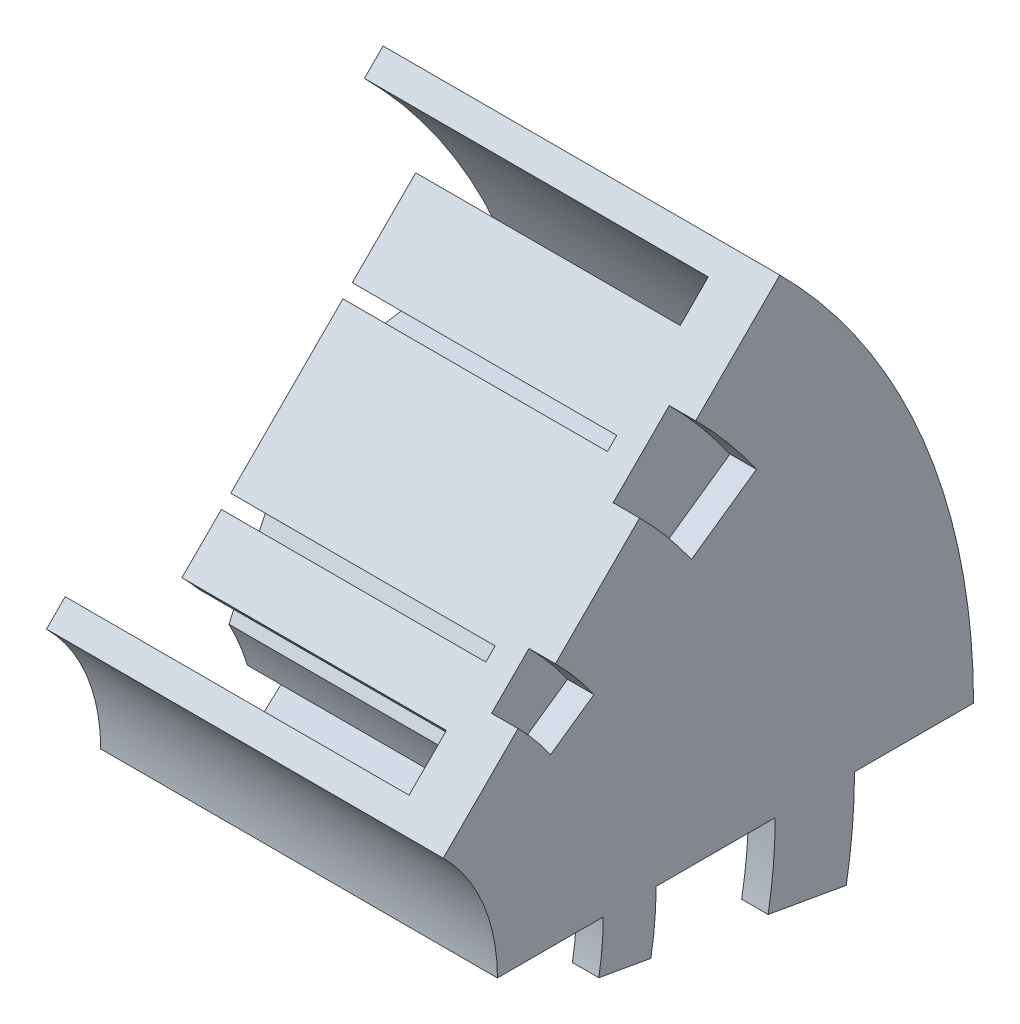
from build123d import *

# Parameters (mm, degrees)
SKETCH3_R               = 165.1
BOSS_EXTRUDE3_DEPTH     = 88.9
CAVITY1_OUTLINE_R       = 152.4
CAVITY1_OUTLINE_R_2     = 50.8
CAVITY1_DEPTH           = 82.55
CAVITY1_2_OUTLINE_R     = 50.8
CAVITY1_2_DEPTH         = 19.05
SKETCH4_R               = 47.625
CUT_EXTRUDE1_DEPTH      = 244.710981492
SKETCH5_R               = 165.1
SKETCH5_R_2             = 155.575
CUT_EXTRUDE2_DEPTH      = 250.838407776
CUT_EXTRUDE3_DEPTH      = 235.992901489
CUT_EXTRUDE3_DEPTH_BACK = 235.992901489
BOSS_EXTRUDE4_DEPTH     = 6.35
BOSS_EXTRUDE5_START     = -95.25
BOSS_EXTRUDE5_DEPTH     = 95.25
BOSS_EXTRUDE6_START     = -76.2
BOSS_EXTRUDE6_DEPTH     = 76.2
BOSS_EXTRUDE7_START     = 19.05
BOSS_EXTRUDE7_DEPTH     = 19.05


# Read off the part's stored shape, not the designer's step: Cavity1
with BuildPart() as part:
    # Sketch3 → Boss-Extrude3 (new body)
    with BuildSketch(Plane(origin=(0, 0, 0), x_dir=(0, 0, -1), z_dir=(1, 0, 0))):
        Circle(SKETCH3_R)
    extrude(amount=BOSS_EXTRUDE3_DEPTH)

    # Cavity1 outline → Cavity1 (cut)
    with BuildSketch(Plane.YZ):
        Circle(CAVITY1_OUTLINE_R)
        with BuildLine():
            ThreePointArc((-80.874334871, -117.782034216), (-101.027881362, -101.027881362), (-117.782034216, -80.874334871))
            Line((-117.782034216, -80.874334871), (-94.778746917, -76.818234675))
            Line((-94.778746917, -76.818234675), (-76.818234675, -94.778746917))
            Line((-76.818234675, -94.778746917), (-80.874334871, -117.782034216))
        make_face(mode=Mode.SUBTRACT)
        with BuildLine():
            ThreePointArc((-29.644909568, -139.765678769), (-54.675895399, -131.999288208), (-77.867142651, -119.791375818))
            Line((-77.867142651, -119.791375818), (-58.16707868, -107.241050926))
            Line((-58.16707868, -107.241050926), (-34.700538554, -116.961210108))
            Line((-34.700538554, -116.961210108), (-29.644909568, -139.765678769))
        make_face(mode=Mode.SUBTRACT)
        Polygon((-27.135112552, -136.417422958), (-32.318310369, -113.037528491), (-19.758046068, -99.330405283), (-13.399363914, -116.800740918), align=None, mode=Mode.SUBTRACT)
        Polygon((-77.274262751, -115.64910694), (-73.115814864, -92.065377038), (-56.266154796, -84.208251511), (-57.077106506, -102.782099343), align=None, mode=Mode.SUBTRACT)
        Polygon((-54.018741267, -105.522753308), (-53.132050408, -85.214193765), (-33.571867462, -72.752982915), (-27.705232431, -75.18302271), (-22.685501123, -97.825567407), (-36.418836172, -112.812872694), align=None, mode=Mode.SUBTRACT)
        Polygon((-19.446749666, -97.765412591), (-22.958048426, -81.926967419), (-14.449239382, -72.641231776), (-10.141622048, -84.476313131), align=None, mode=Mode.SUBTRACT)
        with BuildLine():
            ThreePointArc((-119.791375818, -77.867142651), (-131.999288208, -54.675895399), (-139.765678769, -29.644909568))
            Line((-139.765678769, -29.644909568), (-116.961210108, -34.700538554))
            Line((-116.961210108, -34.700538554), (-107.241050926, -58.16707868))
            Line((-107.241050926, -58.16707868), (-119.791375818, -77.867142651))
        make_face(mode=Mode.SUBTRACT)
        Polygon((-115.64910694, -77.274262751), (-102.782099343, -57.077106506), (-84.208251511, -56.266154796), (-92.065377038, -73.115814864), align=None, mode=Mode.SUBTRACT)
        Polygon((-112.812872694, -36.418836172), (-97.825567407, -22.685501123), (-75.18302271, -27.705232431), (-72.752982915, -33.571867462), (-85.214193765, -53.132050408), (-105.522753308, -54.018741267), align=None, mode=Mode.SUBTRACT)
        Polygon((-136.417422958, -27.135112552), (-116.800740918, -13.399363914), (-99.330405283, -19.758046068), (-113.037528491, -32.318310369), align=None, mode=Mode.SUBTRACT)
        Polygon((-97.765412591, -19.446749666), (-84.476313131, -10.141622048), (-72.641231776, -14.449239382), (-81.926967419, -22.958048426), align=None, mode=Mode.SUBTRACT)
        Polygon((-90.288618857, -76.818234675), (-81.697674049, -58.39489408), (-58.857722433, -54.367594373), (-54.367594373, -58.857722433), (-58.39489408, -81.697674049), (-76.818234675, -90.288618857), align=None, mode=Mode.SUBTRACT)
        Polygon((-41.147952433, -61.582262732), (-41.6973225, -74.164905949), (-55.379657648, -82.88151477), (-52.562564142, -66.904983587), align=None, mode=Mode.SUBTRACT)
        Polygon((-82.88151477, -55.379657648), (-74.164905949, -41.6973225), (-61.582262732, -41.147952433), (-66.904983587, -52.562564142), align=None, mode=Mode.SUBTRACT)
        with BuildLine():
            Line((-58.006231883, -40.991819554), (-48.83234649, -40.591279067))
            ThreePointArc((-48.83234649, -40.591279067), (-44.901280605, -44.901280605), (-40.591279067, -48.83234649))
            Line((-40.591279067, -48.83234649), (-40.991819554, -58.006231883))
            Line((-40.991819554, -58.006231883), (-47.632402282, -61.102786463))
            Line((-47.632402282, -61.102786463), (-61.102786463, -47.632402282))
            Line((-61.102786463, -47.632402282), (-58.006231883, -40.991819554))
        make_face(mode=Mode.SUBTRACT)
        with BuildLine():
            Line((-37.903880189, -60.069527002), (-29.581595449, -56.188781894))
            ThreePointArc((-29.581595449, -56.188781894), (-24.300397955, -58.666350314), (-18.814121964, -60.648815444))
            Line((-18.814121964, -60.648815444), (-15.673479171, -69.2776606))
            Line((-15.673479171, -69.2776606), (-20.623577502, -74.67974499))
            Line((-20.623577502, -74.67974499), (-38.223482596, -67.389625603))
            Line((-38.223482596, -67.389625603), (-37.903880189, -60.069527002))
        make_face(mode=Mode.SUBTRACT)
        with BuildLine():
            Line((-69.2776606, -15.673479171), (-60.648815444, -18.814121964))
            ThreePointArc((-60.648815444, -18.814121964), (-58.666350314, -24.300397955), (-56.188781894, -29.581595449))
            Line((-56.188781894, -29.581595449), (-60.069527002, -37.903880189))
            Line((-60.069527002, -37.903880189), (-67.389625603, -38.223482596))
            Line((-67.389625603, -38.223482596), (-74.67974499, -20.623577502))
            Line((-74.67974499, -20.623577502), (-69.2776606, -15.673479171))
        make_face(mode=Mode.SUBTRACT)
        with BuildLine():
            ThreePointArc((26.097684485, -140.471265708), (0, -142.875), (-26.097684485, -140.471265708))
            Line((-26.097684485, -140.471265708), (-12.7, -121.337389315))
            Line((-12.7, -121.337389315), (12.7, -121.337389315))
            Line((12.7, -121.337389315), (26.097684485, -140.471265708))
        make_face(mode=Mode.SUBTRACT)
        Polygon((27.135112552, -136.417422958), (13.399363914, -116.800740918), (19.758046068, -99.330405283), (32.318310369, -113.037528491), align=None, mode=Mode.SUBTRACT)
        with BuildLine():
            ThreePointArc((77.867142651, -119.791375818), (54.675895399, -131.999288208), (29.644909568, -139.765678769))
            Line((29.644909568, -139.765678769), (34.700538554, -116.961210108))
            Line((34.700538554, -116.961210108), (58.16707868, -107.241050926))
            Line((58.16707868, -107.241050926), (77.867142651, -119.791375818))
        make_face(mode=Mode.SUBTRACT)
        Polygon((-9.525, -118.162389315), (-16.477553736, -99.060404918), (-3.175, -80.062389315), (3.175, -80.062389315), (16.477553736, -99.060404918), (9.525, -118.162389315), align=None, mode=Mode.SUBTRACT)
        Polygon((19.446749666, -97.765412591), (10.141622048, -84.476313131), (14.449239382, -72.641231776), (22.958048426, -81.926967419), align=None, mode=Mode.SUBTRACT)
        Polygon((77.274262751, -115.64910694), (57.077106506, -102.782099343), (56.266154796, -84.208251511), (73.115814864, -92.065377038), align=None, mode=Mode.SUBTRACT)
        Polygon((36.418836172, -112.812872694), (22.685501123, -97.825567407), (27.705232431, -75.18302271), (33.571867462, -72.752982915), (53.132050408, -85.214193765), (54.018741267, -105.522753308), align=None, mode=Mode.SUBTRACT)
        with BuildLine():
            ThreePointArc((117.782034216, -80.874334871), (101.027881362, -101.027881362), (80.874334871, -117.782034216))
            Line((80.874334871, -117.782034216), (76.818234675, -94.778746917))
            Line((76.818234675, -94.778746917), (94.778746917, -76.818234675))
            Line((94.778746917, -76.818234675), (117.782034216, -80.874334871))
        make_face(mode=Mode.SUBTRACT)
        with BuildLine():
            Line((-12.031006336, -70.002193495), (-5.827314658, -63.23205203))
            ThreePointArc((-5.827314658, -63.23205203), (0, -63.5), (5.827314658, -63.23205203))
            Line((5.827314658, -63.23205203), (12.031006336, -70.002193495))
            Line((12.031006336, -70.002193495), (9.525, -76.887389315))
            Line((9.525, -76.887389315), (-9.525, -76.887389315))
            Line((-9.525, -76.887389315), (-12.031006336, -70.002193495))
        make_face(mode=Mode.SUBTRACT)
        with BuildLine():
            Line((15.673479171, -69.2776606), (18.814121964, -60.648815444))
            ThreePointArc((18.814121964, -60.648815444), (24.300397955, -58.666350314), (29.581595449, -56.188781894))
            Line((29.581595449, -56.188781894), (37.903880189, -60.069527002))
            Line((37.903880189, -60.069527002), (38.223482596, -67.389625603))
            Line((38.223482596, -67.389625603), (20.623577502, -74.67974499))
            Line((20.623577502, -74.67974499), (15.673479171, -69.2776606))
        make_face(mode=Mode.SUBTRACT)
        Polygon((55.379657648, -82.88151477), (41.6973225, -74.164905949), (41.147952433, -61.582262732), (52.562564142, -66.904983587), align=None, mode=Mode.SUBTRACT)
        Polygon((76.818234675, -90.288618857), (58.39489408, -81.697674049), (54.367594373, -58.857722433), (58.857722433, -54.367594373), (81.697674049, -58.39489408), (90.288618857, -76.818234675), align=None, mode=Mode.SUBTRACT)
        with BuildLine():
            Line((40.991819554, -58.006231883), (40.591279067, -48.83234649))
            ThreePointArc((40.591279067, -48.83234649), (44.901280605, -44.901280605), (48.83234649, -40.591279067))
            Line((48.83234649, -40.591279067), (58.006231883, -40.991819554))
            Line((58.006231883, -40.991819554), (61.102786463, -47.632402282))
            Line((61.102786463, -47.632402282), (47.632402282, -61.102786463))
            Line((47.632402282, -61.102786463), (40.991819554, -58.006231883))
        make_face(mode=Mode.SUBTRACT)
        Polygon((82.88151477, -55.379657648), (66.904983587, -52.562564142), (61.582262732, -41.147952433), (74.164905949, -41.6973225), align=None, mode=Mode.SUBTRACT)
        with BuildLine():
            Line((60.069527002, -37.903880189), (56.188781894, -29.581595449))
            ThreePointArc((56.188781894, -29.581595449), (58.666350314, -24.300397955), (60.648815444, -18.814121964))
            Line((60.648815444, -18.814121964), (69.2776606, -15.673479171))
            Line((69.2776606, -15.673479171), (74.67974499, -20.623577502))
            Line((74.67974499, -20.623577502), (67.389625603, -38.223482596))
            Line((67.389625603, -38.223482596), (60.069527002, -37.903880189))
        make_face(mode=Mode.SUBTRACT)
        Polygon((115.64910694, -77.274262751), (92.065377038, -73.115814864), (84.208251511, -56.266154796), (102.782099343, -57.077106506), align=None, mode=Mode.SUBTRACT)
        Polygon((105.522753308, -54.018741267), (85.214193765, -53.132050408), (72.752982915, -33.571867462), (75.18302271, -27.705232431), (97.825567407, -22.685501123), (112.812872694, -36.418836172), align=None, mode=Mode.SUBTRACT)
        with BuildLine():
            ThreePointArc((139.765678769, -29.644909568), (131.999288208, -54.675895399), (119.791375818, -77.867142651))
            Line((119.791375818, -77.867142651), (107.241050926, -58.16707868))
            Line((107.241050926, -58.16707868), (116.961210108, -34.700538554))
            Line((116.961210108, -34.700538554), (139.765678769, -29.644909568))
        make_face(mode=Mode.SUBTRACT)
        Polygon((97.765412591, -19.446749666), (81.926967419, -22.958048426), (72.641231776, -14.449239382), (84.476313131, -10.141622048), align=None, mode=Mode.SUBTRACT)
        Polygon((136.417422958, -27.135112552), (113.037528491, -32.318310369), (99.330405283, -19.758046068), (116.800740918, -13.399363914), align=None, mode=Mode.SUBTRACT)
        with BuildLine():
            ThreePointArc((-140.471265708, -26.097684485), (-142.875, 0), (-140.471265708, 26.097684485))
            Line((-140.471265708, 26.097684485), (-121.337389315, 12.7))
            Line((-121.337389315, 12.7), (-121.337389315, -12.7))
            Line((-121.337389315, -12.7), (-140.471265708, -26.097684485))
        make_face(mode=Mode.SUBTRACT)
        Polygon((-136.417422958, 27.135112552), (-113.037528491, 32.318310369), (-99.330405283, 19.758046068), (-116.800740918, 13.399363914), align=None, mode=Mode.SUBTRACT)
        Polygon((-118.162389315, 9.525), (-99.060404918, 16.477553736), (-80.062389315, 3.175), (-80.062389315, -3.175), (-99.060404918, -16.477553736), (-118.162389315, -9.525), align=None, mode=Mode.SUBTRACT)
        Polygon((-97.765412591, 19.446749666), (-81.926967419, 22.958048426), (-72.641231776, 14.449239382), (-84.476313131, 10.141622048), align=None, mode=Mode.SUBTRACT)
        with BuildLine():
            ThreePointArc((-139.765678769, 29.644909568), (-131.999288208, 54.675895399), (-119.791375818, 77.867142651))
            Line((-119.791375818, 77.867142651), (-107.241050926, 58.16707868))
            Line((-107.241050926, 58.16707868), (-116.961210108, 34.700538554))
            Line((-116.961210108, 34.700538554), (-139.765678769, 29.644909568))
        make_face(mode=Mode.SUBTRACT)
        Polygon((-105.522753308, 54.018741267), (-85.214193765, 53.132050408), (-72.752982915, 33.571867462), (-75.18302271, 27.705232431), (-97.825567407, 22.685501123), (-112.812872694, 36.418836172), align=None, mode=Mode.SUBTRACT)
        Polygon((-115.64910694, 77.274262751), (-92.065377038, 73.115814864), (-84.208251511, 56.266154796), (-102.782099343, 57.077106506), align=None, mode=Mode.SUBTRACT)
        with BuildLine():
            Line((-70.002193495, 12.031006336), (-63.23205203, 5.827314658))
            ThreePointArc((-63.23205203, 5.827314658), (-63.5, 0), (-63.23205203, -5.827314658))
            Line((-63.23205203, -5.827314658), (-70.002193495, -12.031006336))
            Line((-70.002193495, -12.031006336), (-76.887389315, -9.525))
            Line((-76.887389315, -9.525), (-76.887389315, 9.525))
            Line((-76.887389315, 9.525), (-70.002193495, 12.031006336))
        make_face(mode=Mode.SUBTRACT)
        with BuildLine():
            Line((-60.069527002, 37.903880189), (-56.188781894, 29.581595449))
            ThreePointArc((-56.188781894, 29.581595449), (-58.666350314, 24.300397955), (-60.648815444, 18.814121964))
            Line((-60.648815444, 18.814121964), (-69.2776606, 15.673479171))
            Line((-69.2776606, 15.673479171), (-74.67974499, 20.623577502))
            Line((-74.67974499, 20.623577502), (-67.389625603, 38.223482596))
            Line((-67.389625603, 38.223482596), (-60.069527002, 37.903880189))
        make_face(mode=Mode.SUBTRACT)
        Polygon((-61.582262732, 41.147952433), (-74.164905949, 41.6973225), (-82.88151477, 55.379657648), (-66.904983587, 52.562564142), align=None, mode=Mode.SUBTRACT)
        with BuildLine():
            Line((-40.991819554, 58.006231883), (-40.591279067, 48.83234649))
            ThreePointArc((-40.591279067, 48.83234649), (-44.901280605, 44.901280605), (-48.83234649, 40.591279067))
            Line((-48.83234649, 40.591279067), (-58.006231883, 40.991819554))
            Line((-58.006231883, 40.991819554), (-61.102786463, 47.632402282))
            Line((-61.102786463, 47.632402282), (-47.632402282, 61.102786463))
            Line((-47.632402282, 61.102786463), (-40.991819554, 58.006231883))
        make_face(mode=Mode.SUBTRACT)
        Polygon((-76.818234675, 90.288618857), (-58.39489408, 81.697674049), (-54.367594373, 58.857722433), (-58.857722433, 54.367594373), (-81.697674049, 58.39489408), (-90.288618857, 76.818234675), align=None, mode=Mode.SUBTRACT)
        Polygon((-41.147952433, 61.582262732), (-52.562564142, 66.904983587), (-55.379657648, 82.88151477), (-41.6973225, 74.164905949), align=None, mode=Mode.SUBTRACT)
        with BuildLine():
            Line((-15.673479171, 69.2776606), (-18.814121964, 60.648815444))
            ThreePointArc((-18.814121964, 60.648815444), (-24.300397955, 58.666350314), (-29.581595449, 56.188781894))
            Line((-29.581595449, 56.188781894), (-37.903880189, 60.069527002))
            Line((-37.903880189, 60.069527002), (-38.223482596, 67.389625603))
            Line((-38.223482596, 67.389625603), (-20.623577502, 74.67974499))
            Line((-20.623577502, 74.67974499), (-15.673479171, 69.2776606))
        make_face(mode=Mode.SUBTRACT)
        with BuildLine():
            ThreePointArc((-117.782034216, 80.874334871), (-101.027881362, 101.027881362), (-80.874334871, 117.782034216))
            Line((-80.874334871, 117.782034216), (-76.818234675, 94.778746917))
            Line((-76.818234675, 94.778746917), (-94.778746917, 76.818234675))
            Line((-94.778746917, 76.818234675), (-117.782034216, 80.874334871))
        make_face(mode=Mode.SUBTRACT)
        Polygon((-36.418836172, 112.812872694), (-22.685501123, 97.825567407), (-27.705232431, 75.18302271), (-33.571867462, 72.752982915), (-53.132050408, 85.214193765), (-54.018741267, 105.522753308), align=None, mode=Mode.SUBTRACT)
        Polygon((-77.274262751, 115.64910694), (-57.077106506, 102.782099343), (-56.266154796, 84.208251511), (-73.115814864, 92.065377038), align=None, mode=Mode.SUBTRACT)
        Polygon((-19.446749666, 97.765412591), (-10.141622048, 84.476313131), (-14.449239382, 72.641231776), (-22.958048426, 81.926967419), align=None, mode=Mode.SUBTRACT)
        with BuildLine():
            ThreePointArc((-77.867142651, 119.791375818), (-54.675895399, 131.999288208), (-29.644909568, 139.765678769))
            Line((-29.644909568, 139.765678769), (-34.700538554, 116.961210108))
            Line((-34.700538554, 116.961210108), (-58.16707868, 107.241050926))
            Line((-58.16707868, 107.241050926), (-77.867142651, 119.791375818))
        make_face(mode=Mode.SUBTRACT)
        Polygon((-27.135112552, 136.417422958), (-13.399363914, 116.800740918), (-19.758046068, 99.330405283), (-32.318310369, 113.037528491), align=None, mode=Mode.SUBTRACT)
        Circle(CAVITY1_OUTLINE_R_2, mode=Mode.SUBTRACT)
        with BuildLine():
            Line((70.002193495, -12.031006336), (63.23205203, -5.827314658))
            ThreePointArc((63.23205203, -5.827314658), (63.5, 0), (63.23205203, 5.827314658))
            Line((63.23205203, 5.827314658), (70.002193495, 12.031006336))
            Line((70.002193495, 12.031006336), (76.887389315, 9.525))
            Line((76.887389315, 9.525), (76.887389315, -9.525))
            Line((76.887389315, -9.525), (70.002193495, -12.031006336))
        make_face(mode=Mode.SUBTRACT)
        with BuildLine():
            Line((56.188781894, 29.581595449), (60.069527002, 37.903880189))
            Line((60.069527002, 37.903880189), (67.389625603, 38.223482596))
            Line((67.389625603, 38.223482596), (74.67974499, 20.623577502))
            Line((74.67974499, 20.623577502), (69.2776606, 15.673479171))
            Line((69.2776606, 15.673479171), (60.648815444, 18.814121964))
            ThreePointArc((60.648815444, 18.814121964), (58.666350314, 24.300397955), (56.188781894, 29.581595449))
        make_face(mode=Mode.SUBTRACT)
        with BuildLine():
            Line((12.031006336, 70.002193495), (5.827314658, 63.23205203))
            ThreePointArc((5.827314658, 63.23205203), (0, 63.5), (-5.827314658, 63.23205203))
            Line((-5.827314658, 63.23205203), (-12.031006336, 70.002193495))
            Line((-12.031006336, 70.002193495), (-9.525, 76.887389315))
            Line((-9.525, 76.887389315), (9.525, 76.887389315))
            Line((9.525, 76.887389315), (12.031006336, 70.002193495))
        make_face(mode=Mode.SUBTRACT)
        with BuildLine():
            Line((37.903880189, 60.069527002), (29.581595449, 56.188781894))
            ThreePointArc((29.581595449, 56.188781894), (24.300397955, 58.666350314), (18.814121964, 60.648815444))
            Line((18.814121964, 60.648815444), (15.673479171, 69.2776606))
            Line((15.673479171, 69.2776606), (20.623577502, 74.67974499))
            Line((20.623577502, 74.67974499), (38.223482596, 67.389625603))
            Line((38.223482596, 67.389625603), (37.903880189, 60.069527002))
        make_face(mode=Mode.SUBTRACT)
        with BuildLine():
            Line((61.102786463, 47.632402282), (58.006231883, 40.991819554))
            Line((58.006231883, 40.991819554), (48.83234649, 40.591279067))
            ThreePointArc((48.83234649, 40.591279067), (44.901280605, 44.901280605), (40.591279067, 48.83234649))
            Line((40.591279067, 48.83234649), (40.991819554, 58.006231883))
            Line((40.991819554, 58.006231883), (47.632402282, 61.102786463))
            Line((47.632402282, 61.102786463), (61.102786463, 47.632402282))
        make_face(mode=Mode.SUBTRACT)
        Polygon((82.88151477, 55.379657648), (74.164905949, 41.6973225), (61.582262732, 41.147952433), (66.904983587, 52.562564142), align=None, mode=Mode.SUBTRACT)
        Polygon((41.147952433, 61.582262732), (41.6973225, 74.164905949), (55.379657648, 82.88151477), (52.562564142, 66.904983587), align=None, mode=Mode.SUBTRACT)
        Polygon((90.288618857, 76.818234675), (81.697674049, 58.39489408), (58.857722433, 54.367594373), (54.367594373, 58.857722433), (58.39489408, 81.697674049), (76.818234675, 90.288618857), align=None, mode=Mode.SUBTRACT)
        Polygon((97.765412591, 19.446749666), (84.476313131, 10.141622048), (72.641231776, 14.449239382), (81.926967419, 22.958048426), align=None, mode=Mode.SUBTRACT)
        Polygon((99.060404918, -16.477553736), (80.062389315, -3.175), (80.062389315, 3.175), (99.060404918, 16.477553736), (118.162389315, 9.525), (118.162389315, -9.525), align=None, mode=Mode.SUBTRACT)
        with BuildLine():
            ThreePointArc((140.471265708, 26.097684485), (142.875, 0), (140.471265708, -26.097684485))
            Line((140.471265708, -26.097684485), (121.337389315, -12.7))
            Line((121.337389315, -12.7), (121.337389315, 12.7))
            Line((121.337389315, 12.7), (140.471265708, 26.097684485))
        make_face(mode=Mode.SUBTRACT)
        Polygon((113.037528491, 32.318310369), (136.417422958, 27.135112552), (116.800740918, 13.399363914), (99.330405283, 19.758046068), align=None, mode=Mode.SUBTRACT)
        Polygon((112.812872694, 36.418836172), (97.825567407, 22.685501123), (75.18302271, 27.705232431), (72.752982915, 33.571867462), (85.214193765, 53.132050408), (105.522753308, 54.018741267), align=None, mode=Mode.SUBTRACT)
        Polygon((115.64910694, 77.274262751), (102.782099343, 57.077106506), (84.208251511, 56.266154796), (92.065377038, 73.115814864), align=None, mode=Mode.SUBTRACT)
        with BuildLine():
            ThreePointArc((119.791375818, 77.867142651), (131.999288208, 54.675895399), (139.765678769, 29.644909568))
            Line((139.765678769, 29.644909568), (116.961210108, 34.700538554))
            Line((116.961210108, 34.700538554), (107.241050926, 58.16707868))
            Line((107.241050926, 58.16707868), (119.791375818, 77.867142651))
        make_face(mode=Mode.SUBTRACT)
        Polygon((14.449239382, 72.641231776), (10.141622048, 84.476313131), (19.446749666, 97.765412591), (22.958048426, 81.926967419), align=None, mode=Mode.SUBTRACT)
        Polygon((9.525, 118.162389315), (16.477553736, 99.060404918), (3.175, 80.062389315), (-3.175, 80.062389315), (-16.477553736, 99.060404918), (-9.525, 118.162389315), align=None, mode=Mode.SUBTRACT)
        Polygon((54.018741267, 105.522753308), (53.132050408, 85.214193765), (33.571867462, 72.752982915), (27.705232431, 75.18302271), (22.685501123, 97.825567407), (36.418836172, 112.812872694), align=None, mode=Mode.SUBTRACT)
        Polygon((77.274262751, 115.64910694), (73.115814864, 92.065377038), (56.266154796, 84.208251511), (57.077106506, 102.782099343), align=None, mode=Mode.SUBTRACT)
        with BuildLine():
            ThreePointArc((-26.097684485, 140.471265708), (0, 142.875), (26.097684485, 140.471265708))
            Line((26.097684485, 140.471265708), (12.7, 121.337389315))
            Line((12.7, 121.337389315), (-12.7, 121.337389315))
            Line((-12.7, 121.337389315), (-26.097684485, 140.471265708))
        make_face(mode=Mode.SUBTRACT)
        Polygon((27.135112552, 136.417422958), (32.318310369, 113.037528491), (19.758046068, 99.330405283), (13.399363914, 116.800740918), align=None, mode=Mode.SUBTRACT)
        with BuildLine():
            ThreePointArc((29.644909568, 139.765678769), (54.675895399, 131.999288208), (77.867142651, 119.791375818))
            Line((77.867142651, 119.791375818), (58.16707868, 107.241050926))
            Line((58.16707868, 107.241050926), (34.700538554, 116.961210108))
            Line((34.700538554, 116.961210108), (29.644909568, 139.765678769))
        make_face(mode=Mode.SUBTRACT)
        with BuildLine():
            ThreePointArc((80.874334871, 117.782034216), (101.027881362, 101.027881362), (117.782034216, 80.874334871))
            Line((117.782034216, 80.874334871), (94.778746917, 76.818234675))
            Line((94.778746917, 76.818234675), (76.818234675, 94.778746917))
            Line((76.818234675, 94.778746917), (80.874334871, 117.782034216))
        make_face(mode=Mode.SUBTRACT)
    extrude(amount=CAVITY1_DEPTH, mode=Mode.SUBTRACT)

    # Cavity1 2 outline → Cavity1 2 (cut)
    with BuildSketch(Plane.YZ):
        Circle(CAVITY1_2_OUTLINE_R)
        with BuildLine():
            Line((121.337389315, -12.7), (140.471265708, -26.097684485))
            ThreePointArc((140.471265708, -26.097684485), (142.875, 0), (140.471265708, 26.097684485))
            Line((140.471265708, 26.097684485), (121.337389315, 12.7))
            Line((121.337389315, 12.7), (121.337389315, -12.7))
        make_face()
        with BuildLine():
            Line((116.961210108, 34.700538554), (139.765678769, 29.644909568))
            ThreePointArc((139.765678769, 29.644909568), (131.999288208, 54.675895399), (119.791375818, 77.867142651))
            Line((119.791375818, 77.867142651), (107.241050926, 58.16707868))
            Line((107.241050926, 58.16707868), (116.961210108, 34.700538554))
        make_face()
        with BuildLine():
            Line((94.778746917, 76.818234675), (117.782034216, 80.874334871))
            ThreePointArc((117.782034216, 80.874334871), (101.027881362, 101.027881362), (80.874334871, 117.782034216))
            Line((80.874334871, 117.782034216), (76.818234675, 94.778746917))
            Line((76.818234675, 94.778746917), (94.778746917, 76.818234675))
        make_face()
        with BuildLine():
            Line((-94.778746917, -76.818234675), (-117.782034216, -80.874334871))
            ThreePointArc((-117.782034216, -80.874334871), (-101.027881362, -101.027881362), (-80.874334871, -117.782034216))
            Line((-80.874334871, -117.782034216), (-76.818234675, -94.778746917))
            Line((-76.818234675, -94.778746917), (-94.778746917, -76.818234675))
        make_face()
        with BuildLine():
            Line((76.818234675, -94.778746917), (80.874334871, -117.782034216))
            ThreePointArc((80.874334871, -117.782034216), (101.027881362, -101.027881362), (117.782034216, -80.874334871))
            Line((117.782034216, -80.874334871), (94.778746917, -76.818234675))
            Line((94.778746917, -76.818234675), (76.818234675, -94.778746917))
        make_face()
        with BuildLine():
            Line((107.241050926, -58.16707868), (119.791375818, -77.867142651))
            ThreePointArc((119.791375818, -77.867142651), (131.999288208, -54.675895399), (139.765678769, -29.644909568))
            Line((139.765678769, -29.644909568), (116.961210108, -34.700538554))
            Line((116.961210108, -34.700538554), (107.241050926, -58.16707868))
        make_face()
        with BuildLine():
            Line((-12.7, -121.337389315), (-26.097684485, -140.471265708))
            ThreePointArc((-26.097684485, -140.471265708), (0, -142.875), (26.097684485, -140.471265708))
            Line((26.097684485, -140.471265708), (12.7, -121.337389315))
            Line((12.7, -121.337389315), (-12.7, -121.337389315))
        make_face()
        with BuildLine():
            Line((-58.16707868, -107.241050926), (-77.867142651, -119.791375818))
            ThreePointArc((-77.867142651, -119.791375818), (-54.675895399, -131.999288208), (-29.644909568, -139.765678769))
            Line((-29.644909568, -139.765678769), (-34.700538554, -116.961210108))
            Line((-34.700538554, -116.961210108), (-58.16707868, -107.241050926))
        make_face()
        with BuildLine():
            Line((34.700538554, -116.961210108), (29.644909568, -139.765678769))
            ThreePointArc((29.644909568, -139.765678769), (54.675895399, -131.999288208), (77.867142651, -119.791375818))
            Line((77.867142651, -119.791375818), (58.16707868, -107.241050926))
            Line((58.16707868, -107.241050926), (34.700538554, -116.961210108))
        make_face()
        with BuildLine():
            Line((-34.700538554, 116.961210108), (-29.644909568, 139.765678769))
            ThreePointArc((-29.644909568, 139.765678769), (-54.675895399, 131.999288208), (-77.867142651, 119.791375818))
            Line((-77.867142651, 119.791375818), (-58.16707868, 107.241050926))
            Line((-58.16707868, 107.241050926), (-34.700538554, 116.961210108))
        make_face()
        with BuildLine():
            Line((58.16707868, 107.241050926), (77.867142651, 119.791375818))
            ThreePointArc((77.867142651, 119.791375818), (54.675895399, 131.999288208), (29.644909568, 139.765678769))
            Line((29.644909568, 139.765678769), (34.700538554, 116.961210108))
            Line((34.700538554, 116.961210108), (58.16707868, 107.241050926))
        make_face()
        with BuildLine():
            Line((12.7, 121.337389315), (26.097684485, 140.471265708))
            ThreePointArc((26.097684485, 140.471265708), (0, 142.875), (-26.097684485, 140.471265708))
            Line((-26.097684485, 140.471265708), (-12.7, 121.337389315))
            Line((-12.7, 121.337389315), (12.7, 121.337389315))
        make_face()
        with BuildLine():
            Line((-121.337389315, 12.7), (-140.471265708, 26.097684485))
            ThreePointArc((-140.471265708, 26.097684485), (-142.875, 0), (-140.471265708, -26.097684485))
            Line((-140.471265708, -26.097684485), (-121.337389315, -12.7))
            Line((-121.337389315, -12.7), (-121.337389315, 12.7))
        make_face()
        with BuildLine():
            Line((-116.961210108, -34.700538554), (-139.765678769, -29.644909568))
            ThreePointArc((-139.765678769, -29.644909568), (-131.999288208, -54.675895399), (-119.791375818, -77.867142651))
            Line((-119.791375818, -77.867142651), (-107.241050926, -58.16707868))
            Line((-107.241050926, -58.16707868), (-116.961210108, -34.700538554))
        make_face()
        with BuildLine():
            Line((-76.818234675, 94.778746917), (-80.874334871, 117.782034216))
            ThreePointArc((-80.874334871, 117.782034216), (-101.027881362, 101.027881362), (-117.782034216, 80.874334871))
            Line((-117.782034216, 80.874334871), (-94.778746917, 76.818234675))
            Line((-94.778746917, 76.818234675), (-76.818234675, 94.778746917))
        make_face()
        with BuildLine():
            Line((-107.241050926, 58.16707868), (-119.791375818, 77.867142651))
            ThreePointArc((-119.791375818, 77.867142651), (-131.999288208, 54.675895399), (-139.765678769, 29.644909568))
            Line((-139.765678769, 29.644909568), (-116.961210108, 34.700538554))
            Line((-116.961210108, 34.700538554), (-107.241050926, 58.16707868))
        make_face()
        Polygon((84.208251511, 56.266154796), (102.782099343, 57.077106506), (115.64910694, 77.274262751), (92.065377038, 73.115814864), align=None)
        Polygon((61.582262732, 41.147952433), (74.164905949, 41.6973225), (82.88151477, 55.379657648), (66.904983587, 52.562564142), align=None)
        with BuildLine():
            Line((48.83234649, 40.591279067), (58.006231883, 40.991819554))
            Line((58.006231883, 40.991819554), (61.102786463, 47.632402282))
            Line((61.102786463, 47.632402282), (47.632402282, 61.102786463))
            Line((47.632402282, 61.102786463), (40.991819554, 58.006231883))
            Line((40.991819554, 58.006231883), (40.591279067, 48.83234649))
            ThreePointArc((40.591279067, 48.83234649), (44.901280605, 44.901280605), (48.83234649, 40.591279067))
        make_face()
        with BuildLine():
            Line((67.389625603, 38.223482596), (60.069527002, 37.903880189))
            Line((60.069527002, 37.903880189), (56.188781894, 29.581595449))
            ThreePointArc((56.188781894, 29.581595449), (58.666350314, 24.300397955), (60.648815444, 18.814121964))
            Line((60.648815444, 18.814121964), (69.2776606, 15.673479171))
            Line((69.2776606, 15.673479171), (74.67974499, 20.623577502))
            Line((74.67974499, 20.623577502), (67.389625603, 38.223482596))
        make_face()
        Polygon((55.379657648, 82.88151477), (41.6973225, 74.164905949), (41.147952433, 61.582262732), (52.562564142, 66.904983587), align=None)
        with BuildLine():
            ThreePointArc((-40.591279067, -48.83234649), (-44.901280605, -44.901280605), (-48.83234649, -40.591279067))
            Line((-48.83234649, -40.591279067), (-58.006231883, -40.991819554))
            Line((-58.006231883, -40.991819554), (-61.102786463, -47.632402282))
            Line((-61.102786463, -47.632402282), (-47.632402282, -61.102786463))
            Line((-47.632402282, -61.102786463), (-40.991819554, -58.006231883))
            Line((-40.991819554, -58.006231883), (-40.591279067, -48.83234649))
        make_face()
        with BuildLine():
            ThreePointArc((5.827314658, -63.23205203), (0, -63.5), (-5.827314658, -63.23205203))
            Line((-5.827314658, -63.23205203), (-12.031006336, -70.002193495))
            Line((-12.031006336, -70.002193495), (-9.525, -76.887389315))
            Line((-9.525, -76.887389315), (9.525, -76.887389315))
            Line((9.525, -76.887389315), (12.031006336, -70.002193495))
            Line((12.031006336, -70.002193495), (5.827314658, -63.23205203))
        make_face()
        with BuildLine():
            ThreePointArc((48.83234649, -40.591279067), (44.901280605, -44.901280605), (40.591279067, -48.83234649))
            Line((40.591279067, -48.83234649), (40.991819554, -58.006231883))
            Line((40.991819554, -58.006231883), (47.632402282, -61.102786463))
            Line((47.632402282, -61.102786463), (61.102786463, -47.632402282))
            Line((61.102786463, -47.632402282), (58.006231883, -40.991819554))
            Line((58.006231883, -40.991819554), (48.83234649, -40.591279067))
        make_face()
        with BuildLine():
            ThreePointArc((63.23205203, 5.827314658), (63.5, 0), (63.23205203, -5.827314658))
            Line((63.23205203, -5.827314658), (70.002193495, -12.031006336))
            Line((70.002193495, -12.031006336), (76.887389315, -9.525))
            Line((76.887389315, -9.525), (76.887389315, 9.525))
            Line((76.887389315, 9.525), (70.002193495, 12.031006336))
            Line((70.002193495, 12.031006336), (63.23205203, 5.827314658))
        make_face()
        with BuildLine():
            ThreePointArc((60.648815444, -18.814121964), (58.666350314, -24.300397955), (56.188781894, -29.581595449))
            Line((56.188781894, -29.581595449), (60.069527002, -37.903880189))
            Line((60.069527002, -37.903880189), (67.389625603, -38.223482596))
            Line((67.389625603, -38.223482596), (74.67974499, -20.623577502))
            Line((74.67974499, -20.623577502), (69.2776606, -15.673479171))
            Line((69.2776606, -15.673479171), (60.648815444, -18.814121964))
        make_face()
        with BuildLine():
            ThreePointArc((-18.814121964, -60.648815444), (-24.300397955, -58.666350314), (-29.581595449, -56.188781894))
            Line((-29.581595449, -56.188781894), (-37.903880189, -60.069527002))
            Line((-37.903880189, -60.069527002), (-38.223482596, -67.389625603))
            Line((-38.223482596, -67.389625603), (-20.623577502, -74.67974499))
            Line((-20.623577502, -74.67974499), (-15.673479171, -69.2776606))
            Line((-15.673479171, -69.2776606), (-18.814121964, -60.648815444))
        make_face()
        with BuildLine():
            ThreePointArc((29.581595449, -56.188781894), (24.300397955, -58.666350314), (18.814121964, -60.648815444))
            Line((18.814121964, -60.648815444), (15.673479171, -69.2776606))
            Line((15.673479171, -69.2776606), (20.623577502, -74.67974499))
            Line((20.623577502, -74.67974499), (38.223482596, -67.389625603))
            Line((38.223482596, -67.389625603), (37.903880189, -60.069527002))
            Line((37.903880189, -60.069527002), (29.581595449, -56.188781894))
        make_face()
        with BuildLine():
            ThreePointArc((-29.581595449, 56.188781894), (-24.300397955, 58.666350314), (-18.814121964, 60.648815444))
            Line((-18.814121964, 60.648815444), (-15.673479171, 69.2776606))
            Line((-15.673479171, 69.2776606), (-20.623577502, 74.67974499))
            Line((-20.623577502, 74.67974499), (-38.223482596, 67.389625603))
            Line((-38.223482596, 67.389625603), (-37.903880189, 60.069527002))
            Line((-37.903880189, 60.069527002), (-29.581595449, 56.188781894))
        make_face()
        with BuildLine():
            ThreePointArc((-48.83234649, 40.591279067), (-44.901280605, 44.901280605), (-40.591279067, 48.83234649))
            Line((-40.591279067, 48.83234649), (-40.991819554, 58.006231883))
            Line((-40.991819554, 58.006231883), (-47.632402282, 61.102786463))
            Line((-47.632402282, 61.102786463), (-61.102786463, 47.632402282))
            Line((-61.102786463, 47.632402282), (-58.006231883, 40.991819554))
            Line((-58.006231883, 40.991819554), (-48.83234649, 40.591279067))
        make_face()
        with BuildLine():
            ThreePointArc((18.814121964, 60.648815444), (24.300397955, 58.666350314), (29.581595449, 56.188781894))
            Line((29.581595449, 56.188781894), (37.903880189, 60.069527002))
            Line((37.903880189, 60.069527002), (38.223482596, 67.389625603))
            Line((38.223482596, 67.389625603), (20.623577502, 74.67974499))
            Line((20.623577502, 74.67974499), (15.673479171, 69.2776606))
            Line((15.673479171, 69.2776606), (18.814121964, 60.648815444))
        make_face()
        with BuildLine():
            ThreePointArc((-5.827314658, 63.23205203), (0, 63.5), (5.827314658, 63.23205203))
            Line((5.827314658, 63.23205203), (12.031006336, 70.002193495))
            Line((12.031006336, 70.002193495), (9.525, 76.887389315))
            Line((9.525, 76.887389315), (-9.525, 76.887389315))
            Line((-9.525, 76.887389315), (-12.031006336, 70.002193495))
            Line((-12.031006336, 70.002193495), (-5.827314658, 63.23205203))
        make_face()
        with BuildLine():
            ThreePointArc((-56.188781894, -29.581595449), (-58.666350314, -24.300397955), (-60.648815444, -18.814121964))
            Line((-60.648815444, -18.814121964), (-69.2776606, -15.673479171))
            Line((-69.2776606, -15.673479171), (-74.67974499, -20.623577502))
            Line((-74.67974499, -20.623577502), (-67.389625603, -38.223482596))
            Line((-67.389625603, -38.223482596), (-60.069527002, -37.903880189))
            Line((-60.069527002, -37.903880189), (-56.188781894, -29.581595449))
        make_face()
        with BuildLine():
            ThreePointArc((-63.23205203, -5.827314658), (-63.5, 0), (-63.23205203, 5.827314658))
            Line((-63.23205203, 5.827314658), (-70.002193495, 12.031006336))
            Line((-70.002193495, 12.031006336), (-76.887389315, 9.525))
            Line((-76.887389315, 9.525), (-76.887389315, -9.525))
            Line((-76.887389315, -9.525), (-70.002193495, -12.031006336))
            Line((-70.002193495, -12.031006336), (-63.23205203, -5.827314658))
        make_face()
        with BuildLine():
            ThreePointArc((-60.648815444, 18.814121964), (-58.666350314, 24.300397955), (-56.188781894, 29.581595449))
            Line((-56.188781894, 29.581595449), (-60.069527002, 37.903880189))
            Line((-60.069527002, 37.903880189), (-67.389625603, 38.223482596))
            Line((-67.389625603, 38.223482596), (-74.67974499, 20.623577502))
            Line((-74.67974499, 20.623577502), (-69.2776606, 15.673479171))
            Line((-69.2776606, 15.673479171), (-60.648815444, 18.814121964))
        make_face()
        Polygon((56.266154796, 84.208251511), (73.115814864, 92.065377038), (77.274262751, 115.64910694), (57.077106506, 102.782099343), align=None)
        Polygon((58.857722433, 54.367594373), (81.697674049, 58.39489408), (90.288618857, 76.818234675), (76.818234675, 90.288618857), (58.39489408, 81.697674049), (54.367594373, 58.857722433), align=None)
        Polygon((72.641231776, -14.449239382), (81.926967419, -22.958048426), (97.765412591, -19.446749666), (84.476313131, -10.141622048), align=None)
        Polygon((-72.641231776, 14.449239382), (-81.926967419, 22.958048426), (-97.765412591, 19.446749666), (-84.476313131, 10.141622048), align=None)
        Polygon((-99.330405283, 19.758046068), (-113.037528491, 32.318310369), (-136.417422958, 27.135112552), (-116.800740918, 13.399363914), align=None)
        Polygon((72.641231776, 14.449239382), (84.476313131, 10.141622048), (97.765412591, 19.446749666), (81.926967419, 22.958048426), align=None)
        Polygon((75.18302271, 27.705232431), (97.825567407, 22.685501123), (112.812872694, 36.418836172), (105.522753308, 54.018741267), (85.214193765, 53.132050408), (72.752982915, 33.571867462), align=None)
        Polygon((116.800740918, 13.399363914), (136.417422958, 27.135112552), (113.037528491, 32.318310369), (99.330405283, 19.758046068), align=None)
        Polygon((19.758046068, -99.330405283), (13.399363914, -116.800740918), (27.135112552, -136.417422958), (32.318310369, -113.037528491), align=None)
        Polygon((41.147952433, -61.582262732), (41.6973225, -74.164905949), (55.379657648, -82.88151477), (52.562564142, -66.904983587), align=None)
        Polygon((56.266154796, -84.208251511), (57.077106506, -102.782099343), (77.274262751, -115.64910694), (73.115814864, -92.065377038), align=None)
        Polygon((99.330405283, -19.758046068), (113.037528491, -32.318310369), (136.417422958, -27.135112552), (116.800740918, -13.399363914), align=None)
        Polygon((84.208251511, -56.266154796), (92.065377038, -73.115814864), (115.64910694, -77.274262751), (102.782099343, -57.077106506), align=None)
        Polygon((61.582262732, -41.147952433), (66.904983587, -52.562564142), (82.88151477, -55.379657648), (74.164905949, -41.6973225), align=None)
        Polygon((-55.379657648, -82.88151477), (-41.6973225, -74.164905949), (-41.147952433, -61.582262732), (-52.562564142, -66.904983587), align=None)
        Polygon((-61.582262732, -41.147952433), (-74.164905949, -41.6973225), (-82.88151477, -55.379657648), (-66.904983587, -52.562564142), align=None)
        Polygon((-58.857722433, -54.367594373), (-81.697674049, -58.39489408), (-90.288618857, -76.818234675), (-76.818234675, -90.288618857), (-58.39489408, -81.697674049), (-54.367594373, -58.857722433), align=None)
        Polygon((14.449239382, -72.641231776), (10.141622048, -84.476313131), (19.446749666, -97.765412591), (22.958048426, -81.926967419), align=None)
        Polygon((-14.449239382, -72.641231776), (-22.958048426, -81.926967419), (-19.446749666, -97.765412591), (-10.141622048, -84.476313131), align=None)
        Polygon((-19.758046068, -99.330405283), (-32.318310369, -113.037528491), (-27.135112552, -136.417422958), (-13.399363914, -116.800740918), align=None)
        Polygon((-84.208251511, -56.266154796), (-102.782099343, -57.077106506), (-115.64910694, -77.274262751), (-92.065377038, -73.115814864), align=None)
        Polygon((-56.266154796, -84.208251511), (-73.115814864, -92.065377038), (-77.274262751, -115.64910694), (-57.077106506, -102.782099343), align=None)
        Polygon((54.367594373, -58.857722433), (58.39489408, -81.697674049), (76.818234675, -90.288618857), (90.288618857, -76.818234675), (81.697674049, -58.39489408), (58.857722433, -54.367594373), align=None)
        Polygon((80.062389315, 3.175), (80.062389315, -3.175), (99.060404918, -16.477553736), (118.162389315, -9.525), (118.162389315, 9.525), (99.060404918, 16.477553736), align=None)
        Polygon((72.752982915, -33.571867462), (85.214193765, -53.132050408), (105.522753308, -54.018741267), (112.812872694, -36.418836172), (97.825567407, -22.685501123), (75.18302271, -27.705232431), align=None)
        Polygon((-33.571867462, -72.752982915), (-53.132050408, -85.214193765), (-54.018741267, -105.522753308), (-36.418836172, -112.812872694), (-22.685501123, -97.825567407), (-27.705232431, -75.18302271), align=None)
        Polygon((27.705232431, -75.18302271), (22.685501123, -97.825567407), (36.418836172, -112.812872694), (54.018741267, -105.522753308), (53.132050408, -85.214193765), (33.571867462, -72.752982915), align=None)
        Polygon((-3.175, -80.062389315), (-16.477553736, -99.060404918), (-9.525, -118.162389315), (9.525, -118.162389315), (16.477553736, -99.060404918), (3.175, -80.062389315), align=None)
        Polygon((-55.379657648, 82.88151477), (-52.562564142, 66.904983587), (-41.147952433, 61.582262732), (-41.6973225, 74.164905949), align=None)
        Polygon((-14.449239382, 72.641231776), (-10.141622048, 84.476313131), (-19.446749666, 97.765412591), (-22.958048426, 81.926967419), align=None)
        Polygon((-27.705232431, 75.18302271), (-22.685501123, 97.825567407), (-36.418836172, 112.812872694), (-54.018741267, 105.522753308), (-53.132050408, 85.214193765), (-33.571867462, 72.752982915), align=None)
        Polygon((-19.758046068, 99.330405283), (-13.399363914, 116.800740918), (-27.135112552, 136.417422958), (-32.318310369, 113.037528491), align=None)
        Polygon((-56.266154796, 84.208251511), (-57.077106506, 102.782099343), (-77.274262751, 115.64910694), (-73.115814864, 92.065377038), align=None)
        Polygon((-82.88151477, 55.379657648), (-74.164905949, 41.6973225), (-61.582262732, 41.147952433), (-66.904983587, 52.562564142), align=None)
        Polygon((19.758046068, 99.330405283), (32.318310369, 113.037528491), (27.135112552, 136.417422958), (13.399363914, 116.800740918), align=None)
        Polygon((19.446749666, 97.765412591), (10.141622048, 84.476313131), (14.449239382, 72.641231776), (22.958048426, 81.926967419), align=None)
        Polygon((33.571867462, 72.752982915), (53.132050408, 85.214193765), (54.018741267, 105.522753308), (36.418836172, 112.812872694), (22.685501123, 97.825567407), (27.705232431, 75.18302271), align=None)
        Polygon((3.175, 80.062389315), (16.477553736, 99.060404918), (9.525, 118.162389315), (-9.525, 118.162389315), (-16.477553736, 99.060404918), (-3.175, 80.062389315), align=None)
        Polygon((-72.641231776, -14.449239382), (-84.476313131, -10.141622048), (-97.765412591, -19.446749666), (-81.926967419, -22.958048426), align=None)
        Polygon((-99.330405283, -19.758046068), (-116.800740918, -13.399363914), (-136.417422958, -27.135112552), (-113.037528491, -32.318310369), align=None)
        Polygon((-80.062389315, 3.175), (-99.060404918, 16.477553736), (-118.162389315, 9.525), (-118.162389315, -9.525), (-99.060404918, -16.477553736), (-80.062389315, -3.175), align=None)
        Polygon((-75.18302271, -27.705232431), (-97.825567407, -22.685501123), (-112.812872694, -36.418836172), (-105.522753308, -54.018741267), (-85.214193765, -53.132050408), (-72.752982915, -33.571867462), align=None)
        Polygon((-84.208251511, 56.266154796), (-92.065377038, 73.115814864), (-115.64910694, 77.274262751), (-102.782099343, 57.077106506), align=None)
        Polygon((-54.367594373, 58.857722433), (-58.39489408, 81.697674049), (-76.818234675, 90.288618857), (-90.288618857, 76.818234675), (-81.697674049, 58.39489408), (-58.857722433, 54.367594373), align=None)
        Polygon((-72.752982915, 33.571867462), (-85.214193765, 53.132050408), (-105.522753308, 54.018741267), (-112.812872694, 36.418836172), (-97.825567407, 22.685501123), (-75.18302271, 27.705232431), align=None)
    extrude(amount=CAVITY1_2_DEPTH, mode=Mode.SUBTRACT)

    # Sketch4 → Cut-Extrude1 (cut, through all)
    with BuildSketch(Plane.ZY.offset(-19.05)):
        Circle(SKETCH4_R)
    extrude(amount=-CUT_EXTRUDE1_DEPTH, mode=Mode.SUBTRACT)

    # Sketch5 → Cut-Extrude2 (cut, through all)
    with BuildSketch(Plane.ZY):
        Circle(SKETCH5_R)
        Circle(SKETCH5_R_2, mode=Mode.SUBTRACT)
    extrude(amount=-CUT_EXTRUDE2_DEPTH, mode=Mode.SUBTRACT)

    # Sketch6 → Cut-Extrude3 (cut, two sides: drawn at the far end of the back side and taken through both)
    with BuildSketch(Plane.ZY.offset(-82.55).offset(-CUT_EXTRUDE3_DEPTH_BACK)):
        with BuildLine():
            Line((0, 0), (-155.575, 0))
            ThreePointArc((-155.575, 0), (143.73255827, -59.53597499), (-110.008137483, 110.008137483))
            Line((-110.008137483, 110.008137483), (0, 0))
        make_face()
    extrude(amount=CUT_EXTRUDE3_DEPTH + CUT_EXTRUDE3_DEPTH_BACK, mode=Mode.SUBTRACT)

    # Sketch7 → Boss-Extrude4 (add)
    with BuildSketch(Plane(origin=(88.9, 0, 0), x_dir=(0, 0, -1), z_dir=(1, 0, 0))):
        with BuildLine():
            Line((57.217770294, 40.064314079), (67.621001256, 47.348734821))
            ThreePointArc((67.621001256, 47.348734821), (63.236968779, 53.06211718), (58.371664787, 58.371664787))
            Line((58.371664787, 58.371664787), (78.577241059, 78.577241059))
            ThreePointArc((78.577241059, 78.577241059), (85.126688742, 71.429773126), (91.028270922, 63.73868149))
            Line((91.028270922, 63.73868149), (106.633117365, 74.665312602))
            ThreePointArc((106.633117365, 74.665312602), (99.719835383, 83.674877091), (92.047625241, 92.047625241))
            Line((92.047625241, 92.047625241), (110.008137483, 110.008137483))
            ThreePointArc((110.008137483, 110.008137483), (143.73255827, 59.53597499), (155.575, 0))
            Line((155.575, 0), (130.175, 0))
            ThreePointArc((130.175, 0), (129.679644824, -11.345498812), (128.197349248, -22.604651528))
            Line((128.197349248, -22.604651528), (109.436761553, -19.296653743))
            ThreePointArc((109.436761553, -19.296653743), (110.702135825, -9.685181913), (111.125, 0))
            Line((111.125, 0), (82.55, 0))
            ThreePointArc((82.55, 0), (82.235872327, -7.194706564), (81.295880011, -14.334657066))
            Line((81.295880011, -14.334657066), (68.788821548, -12.12932521))
            ThreePointArc((68.788821548, -12.12932521), (69.584199662, -6.087828631), (69.85, 0))
            Line((69.85, 0), (47.625, 0))
            ThreePointArc((47.625, 0), (43.999762736, 18.225298466), (33.675960454, 33.675960454))
            Line((33.675960454, 33.675960454), (49.391408666, 49.391408666))
            ThreePointArc((49.391408666, 49.391408666), (53.508204352, 44.898714537), (57.217770294, 40.064314079))
        make_face()
    extrude(amount=BOSS_EXTRUDE4_DEPTH)

    # Sketch8 → Boss-Extrude5 (add)
    with BuildSketch(Plane(origin=(95.25, 0, 0), x_dir=(0, 0, -1), z_dir=(1, 0, 0)).offset(BOSS_EXTRUDE5_START)):
        with BuildLine():
            Line((155.575, 0), (158.75, 0))
            ThreePointArc((158.75, 0), (146.665875786, 60.750994888), (112.253201513, 112.253201513))
            Line((112.253201513, 112.253201513), (110.008137483, 110.008137483))
            ThreePointArc((110.008137483, 110.008137483), (143.73255827, 59.53597499), (155.575, 0))
        make_face()
    extrude(amount=BOSS_EXTRUDE5_DEPTH)

    # Sketch8<3> → Boss-Extrude6 (add)
    with BuildSketch(Plane(origin=(95.25, 0, 0), x_dir=(0, 0, -1), z_dir=(1, 0, 0)).offset(BOSS_EXTRUDE6_START)):
        with BuildLine():
            Line((44.45, 0), (47.625, 0))
            ThreePointArc((47.625, 0), (43.999762736, 18.225298466), (33.675960454, 33.675960454))
            Line((33.675960454, 33.675960454), (31.430896424, 31.430896424))
            ThreePointArc((31.430896424, 31.430896424), (41.06644522, 17.010278569), (44.45, 0))
        make_face()
    extrude(amount=BOSS_EXTRUDE6_DEPTH)

    # Sketch9 → Boss-Extrude7 (add)
    with BuildSketch(Plane.ZY.offset(-19.05).offset(BOSS_EXTRUDE7_START)):
        with BuildLine():
            ThreePointArc((-44.45, 0), (-41.06644522, 17.010278569), (-31.430896424, 31.430896424))
            Line((-31.430896424, 31.430896424), (-35.921024484, 35.921024484))
            ThreePointArc((-35.921024484, 35.921024484), (-46.933080252, 19.440318364), (-50.8, 0))
            Line((-50.8, 0), (-44.45, 0))
        make_face()
    extrude(amount=-BOSS_EXTRUDE7_DEPTH)


solid = part.part
